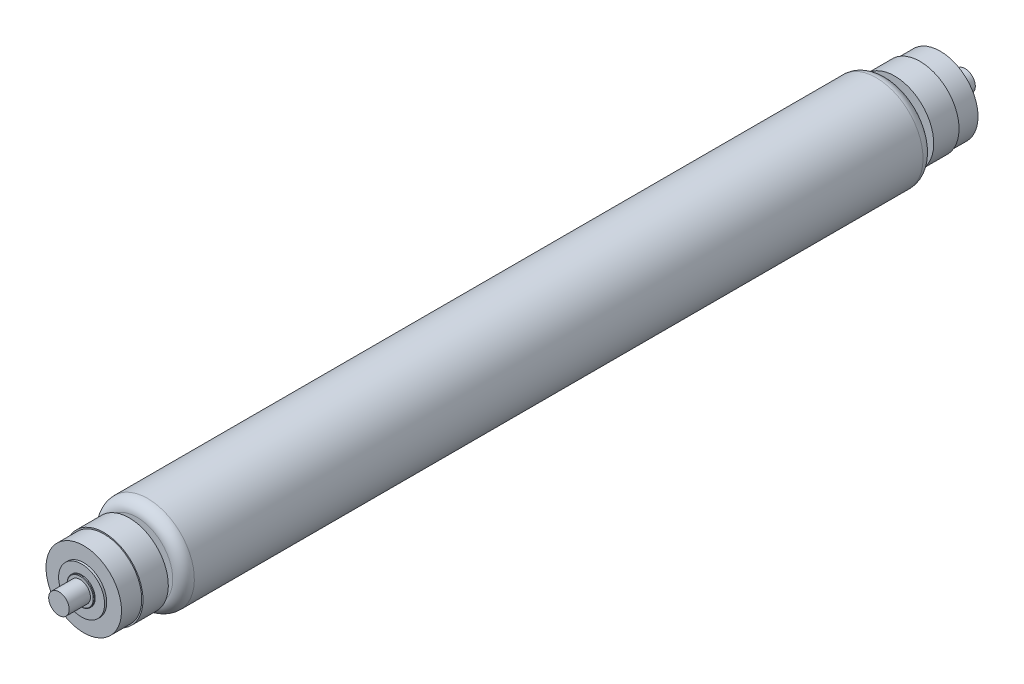
from build123d import *


with BuildPart() as part:
    # Sketch3 → Revolve1 (revolve)
    with BuildSketch(Plane(origin=(0, 0, 0), x_dir=(0, 0, -1), z_dir=(1, 0, 0))):
        with BuildLine():
            Line((-192.3288, -10.9855), (-20.8788, -10.9855))
            ThreePointArc((-20.8788, -10.9855), (-19.082748776, -10.241551224), (-18.3388, -8.4455))
            Line((-18.3388, -8.4455), (-18.3388, -4.207282051))
            Line((-18.3388, -4.207282051), (-16.5608, -6.35))
            Line((-16.5608, -6.35), (-16.5608, -9.1821))
            Line((-16.5608, -9.1821), (-10.6045, -9.1821))
            Line((-10.6045, -9.1821), (-10.6045, -8.884691146))
            Line((-10.6045, -8.884691146), (-5.842, -8.884691146))
            Line((-5.842, -8.884691146), (-5.842, -5.4102))
            Line((-5.842, -5.4102), (-5.334, -5.4102))
            Line((-5.334, -5.4102), (-5.334, -3.192668748))
            Line((-5.334, -3.192668748), (-5.131990244, -3.192668748))
            Line((-5.131990244, -3.192668748), (-5.0038, -3.06447825))
            Line((-5.0038, -3.06447825), (-5.0038, -2.413))
            Line((-5.0038, -2.413), (0, -2.413))
            Line((0, -2.413), (0, 0))
            Line((0, 0), (-213.2076, 0))
            Line((-213.2076, 0), (-213.2076, -2.413))
            Line((-213.2076, -2.413), (-208.2038, -2.413))
            Line((-208.2038, -2.413), (-208.2038, -3.06447825))
            Line((-208.2038, -3.06447825), (-208.075609756, -3.192668748))
            Line((-208.075609756, -3.192668748), (-207.8736, -3.192668748))
            Line((-207.8736, -3.192668748), (-207.8736, -5.4102))
            Line((-207.8736, -5.4102), (-207.3656, -5.4102))
            Line((-207.3656, -5.4102), (-207.3656, -8.884691146))
            Line((-207.3656, -8.884691146), (-202.6031, -8.884691146))
            Line((-202.6031, -8.884691146), (-202.6031, -9.1821))
            Line((-202.6031, -9.1821), (-196.6468, -9.1821))
            Line((-196.6468, -9.1821), (-196.6468, -6.35))
            Line((-196.6468, -6.35), (-194.8688, -4.207282051))
            Line((-194.8688, -4.207282051), (-194.8688, -8.4455))
            ThreePointArc((-194.8688, -8.4455), (-194.124851224, -10.241551224), (-192.3288, -10.9855))
        make_face()
    revolve(axis=Axis((0, 0, 0), (0, 0, 1)))


solid = part.part
